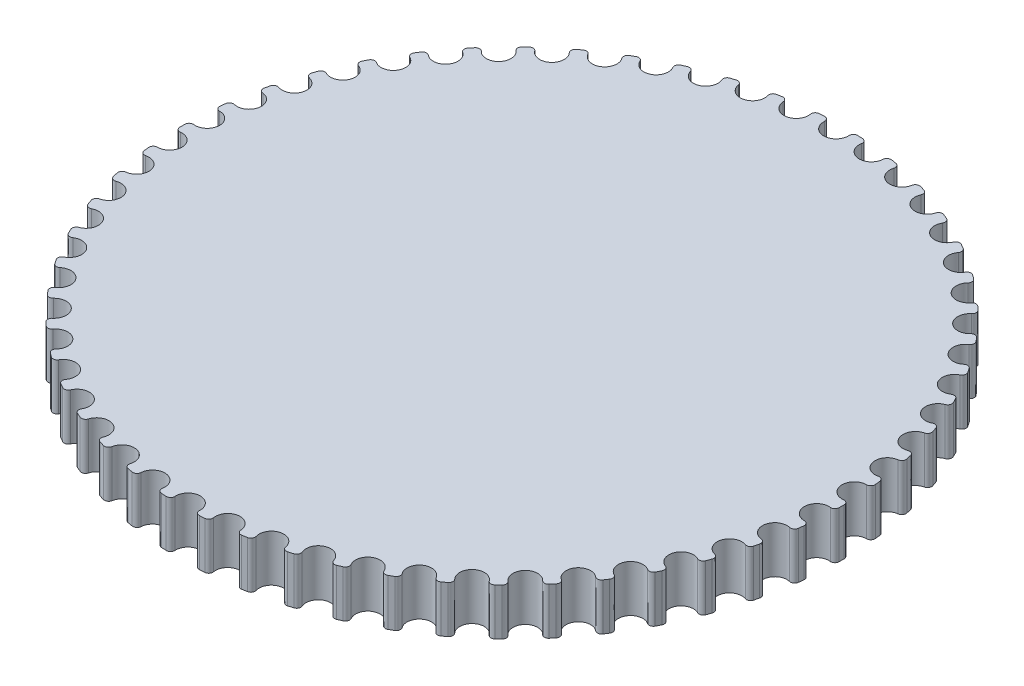
from build123d import *

# Parameters (mm, degrees)
BOSS_EXTRUDE1_DEPTH = 5.999999938


with BuildPart() as part:
    # Sketch1 → Boss-Extrude1 (new body)
    with BuildSketch(Plane(origin=(0, 0, 0), x_dir=(1, 0, 0), z_dir=(0, 1, 0))):
        with BuildLine():
            ThreePointArc((41.613520685, 0.849001706), (39.857037717, 2.321408094), (41.430708027, 3.987773823))
            ThreePointArc((41.430708027, 3.987773823), (41.828156273, 4.164854384), (41.961479983, 4.57903722))
            ThreePointArc((41.961479983, 4.57903722), (41.943633136, 4.739728218), (41.925170927, 4.90034968))
            ThreePointArc((41.925170927, 4.90034968), (41.906093626, 5.060899247), (41.886401515, 5.221374565))
            ThreePointArc((41.886401515, 5.221374565), (41.661154427, 5.593646485), (41.233581862, 5.674295944))
            ThreePointArc((41.233581862, 5.674295944), (39.318039656, 6.93283122), (40.687616117, 8.770621552))
            ThreePointArc((40.687616117, 8.770621552), (41.061819161, 8.992645683), (41.146157692, 9.4195059))
            ThreePointArc((41.146157692, 9.4195059), (41.109776432, 9.577038471), (41.072792045, 9.734430536))
            ThreePointArc((41.072792045, 9.734430536), (41.035205071, 9.891679785), (40.997016063, 10.048783912))
            ThreePointArc((40.997016063, 10.048783912), (40.730073884, 10.392389072), (40.296029581, 10.422855063))
            ThreePointArc((40.296029581, 10.422855063), (38.247332558, 11.450499697), (39.394293997, 13.43486167))
            ThreePointArc((39.394293997, 13.43486167), (39.740191387, 13.698826875), (39.774404204, 14.132591923))
            ThreePointArc((39.774404204, 14.132591923), (39.719980526, 14.284835708), (39.66497411, 14.436869919))
            ThreePointArc((39.66497411, 14.436869919), (39.609385763, 14.588692324), (39.553216299, 14.740300695))
            ThreePointArc((39.553216299, 14.740300695), (39.248188963, 15.050592425), (38.813542627, 15.030462947))
            ThreePointArc((38.813542627, 15.030462947), (36.6593959, 15.813319808), (37.568231632, 17.917418332))
            ThreePointArc((37.568231632, 17.917418332), (37.881145697, 18.219754935), (37.864770131, 18.654558884))
            ThreePointArc((37.864770131, 18.654558884), (37.793040022, 18.799455048), (37.720755445, 18.944075402))
            ThreePointArc((37.720755445, 18.944075402), (37.647917461, 19.088417825), (37.574527138, 19.232480199))
            ThreePointArc((37.574527138, 19.232480199), (37.235539616, 19.505262334), (36.806169093, 19.434809605))
            ThreePointArc((36.806169093, 19.434809605), (34.575703801, 19.962291897), (35.234123382, 22.157672648))
            ThreePointArc((35.234123382, 22.157672648), (35.509822497, 22.494292064), (35.443079999, 22.924254937))
            ThreePointArc((35.443079999, 22.924254937), (35.355013485, 23.059844008), (35.266428272, 23.195094764))
            ThreePointArc((35.266428272, 23.195094764), (35.17732566, 23.330005221), (35.087706955, 23.4645734))
            ThreePointArc((35.087706955, 23.4645734), (34.719343473, 23.696157031), (34.301055262, 23.576333803))
            ThreePointArc((34.301055262, 23.576333803), (32.024434622, 23.841308233), (32.423534056, 26.098282452))
            ThreePointArc((32.423534056, 26.098282452), (32.658289863, 26.464632482), (32.542083011, 26.883939769))
            ThreePointArc((32.542083011, 26.883939769), (32.438871042, 27.008388137), (32.335183156, 27.13244026))
            ThreePointArc((32.335183156, 27.13244026), (32.231020875, 27.256094319), (32.126385728, 27.379348499))
            ThreePointArc((32.126385728, 27.379348499), (31.733627769, 27.566601854), (31.332078502, 27.399028531))
            ThreePointArc((31.332078502, 27.399028531), (29.040089902, 27.397911774), (29.174472055, 29.685957758))
            ThreePointArc((29.174472055, 29.685957758), (29.365109884, 30.077084145), (29.201010177, 30.480065434))
            ThreePointArc((29.201010177, 30.480065434), (29.084048516, 30.591690148), (28.966660158, 30.702866047))
            ThreePointArc((28.966660158, 30.702866047), (28.848846825, 30.813591499), (28.730610247, 30.923864879))
            ThreePointArc((28.730610247, 30.923864879), (28.318769189, 31.064255678), (27.939389129, 30.8511984))
            ThreePointArc((27.939389129, 30.8511984), (25.663027784, 30.584005559), (25.530875367, 32.87218141))
            ThreePointArc((25.530875367, 32.87218141), (25.67481717, 33.282794842), (25.465043773, 33.664000502))
            ThreePointArc((25.465043773, 33.664000502), (25.335914127, 33.76129203), (25.206412773, 33.858088241))
            ThreePointArc((25.206412773, 33.858088241), (25.076541612, 33.954387713), (24.946302549, 34.050189036))
            ThreePointArc((24.946302549, 34.050189036), (24.520947836, 34.141818734), (24.168867449, 33.886158737))
            ThreePointArc((24.168867449, 33.886158737), (21.93891724, 33.356503135), (21.542017388, 35.613865201))
            ThreePointArc((21.542017388, 35.613865201), (21.637316598, 36.038412835), (21.384706338, 36.392687714))
            ThreePointArc((21.384706338, 36.392687714), (21.245154963, 36.474330354), (21.105291897, 36.555437874))
            ThreePointArc((21.105291897, 36.555437874), (20.965119191, 36.636009082), (20.824638903, 36.716042798))
            ThreePointArc((20.824638903, 36.716042798), (20.391522728, 36.757672261), (20.071503297, 36.462866907))
            ThreePointArc((20.071503297, 36.462866907), (17.918120476, 35.677911229), (17.261840578, 37.873932559))
            ThreePointArc((17.261840578, 37.873932559), (17.307208437, 38.306673117), (17.015177434, 38.629226255))
            ThreePointArc((17.015177434, 38.629226255), (16.867091524, 38.694115932), (16.718758153, 38.75843792))
            ThreePointArc((16.718758153, 38.75843792), (16.570179499, 38.822191277), (16.421357741, 38.885375067))
            ThreePointArc((16.421357741, 38.885375067), (15.986337257, 38.876441328), (15.702706495, 38.546477354))
            ThreePointArc((15.702706495, 38.546477354), (13.655011871, 37.516836779), (12.748226987, 39.621819952))
            ThreePointArc((12.748226987, 39.621819952), (12.743049972, 40.056901361), (12.415547445, 40.343370779))
            ThreePointArc((12.415547445, 40.343370779), (12.260929607, 40.39062997), (12.106131887, 40.437296583))
            ThreePointArc((12.106131887, 40.437296583), (11.951156555, 40.483369934), (11.796005887, 40.528849346))
            ThreePointArc((11.796005887, 40.528849346), (11.364963999, 40.469473217), (11.121557526, 40.10881282))
            ThreePointArc((11.121557526, 40.10881282), (9.207242656, 38.84841147), (8.062215496, 40.833890201))
            ThreePointArc((8.062215496, 40.833890201), (8.006563617, 41.26542873), (7.648018475, 41.511940422))
            ThreePointArc((7.648018475, 41.511940422), (7.488959651, 41.540930028), (7.329790954, 41.569310179))
            ThreePointArc((7.329790954, 41.569310179), (7.170514721, 41.597080461), (7.011133288, 41.624240464))
            ThreePointArc((7.011133288, 41.624240464), (6.5898991, 41.515224907), (6.390008571, 41.128745399))
            ThreePointArc((6.390008571, 41.128745399), (4.634961278, 39.654628041), (3.26717637, 41.493752135))
            ThreePointArc((3.26717637, 41.493752135), (3.161802225, 41.915911965), (2.777063176, 42.119132284))
            ThreePointArc((2.777063176, 42.119132284), (2.615714362, 42.129460269), (2.454327173, 42.139170167))
            ThreePointArc((2.454327173, 42.139170167), (2.292903976, 42.148261833), (2.131447139, 42.156735136))
            ThreePointArc((2.131447139, 42.156735136), (1.725717119, 41.999554398), (1.572045711, 41.592482253))
            ThreePointArc((1.572045711, 41.592482253), (0, 39.924583794), (-1.572045711, 41.592482253))
            ThreePointArc((-1.572045711, 41.592482253), (-1.725717119, 41.999554398), (-2.131447139, 42.156735136))
            ThreePointArc((-2.131447139, 42.156735136), (-2.292903976, 42.148261833), (-2.454327173, 42.139170167))
            ThreePointArc((-2.454327173, 42.139170167), (-2.615714362, 42.129460269), (-2.777063176, 42.119132284))
            ThreePointArc((-2.777063176, 42.119132284), (-3.161802225, 41.915911965), (-3.26717637, 41.493752135))
            ThreePointArc((-3.26717637, 41.493752135), (-4.634961278, 39.654628041), (-6.390008571, 41.128745399))
            ThreePointArc((-6.390008571, 41.128745399), (-6.5898991, 41.515224907), (-7.011133288, 41.624240464))
            ThreePointArc((-7.011133288, 41.624240464), (-7.170514721, 41.597080461), (-7.329790954, 41.569310179))
            ThreePointArc((-7.329790954, 41.569310179), (-7.488959651, 41.540930028), (-7.648018475, 41.511940422))
            ThreePointArc((-7.648018475, 41.511940422), (-8.006563617, 41.26542873), (-8.062215496, 40.833890201))
            ThreePointArc((-8.062215496, 40.833890201), (-9.207242656, 38.84841147), (-11.121557526, 40.10881282))
            ThreePointArc((-11.121557526, 40.10881282), (-11.364963999, 40.469473217), (-11.796005887, 40.528849346))
            ThreePointArc((-11.796005887, 40.528849346), (-11.951156555, 40.483369934), (-12.106131887, 40.437296583))
            ThreePointArc((-12.106131887, 40.437296583), (-12.260929607, 40.39062997), (-12.415547445, 40.343370779))
            ThreePointArc((-12.415547445, 40.343370779), (-12.743049972, 40.056901361), (-12.748226987, 39.621819952))
            ThreePointArc((-12.748226987, 39.621819952), (-13.655011871, 37.516836779), (-15.702706495, 38.546477354))
            ThreePointArc((-15.702706495, 38.546477354), (-15.986337257, 38.876441328), (-16.421357741, 38.885375067))
            ThreePointArc((-16.421357741, 38.885375067), (-16.570179499, 38.822191277), (-16.718758153, 38.75843792))
            ThreePointArc((-16.718758153, 38.75843792), (-16.867091524, 38.694115932), (-17.015177434, 38.629226255))
            ThreePointArc((-17.015177434, 38.629226255), (-17.307208437, 38.306673117), (-17.261840578, 37.873932559))
            ThreePointArc((-17.261840578, 37.873932559), (-17.918120476, 35.677911229), (-20.071503297, 36.462866907))
            ThreePointArc((-20.071503297, 36.462866907), (-20.391522728, 36.757672261), (-20.824638903, 36.716042798))
            ThreePointArc((-20.824638903, 36.716042798), (-20.965119191, 36.636009082), (-21.105291897, 36.555437874))
            ThreePointArc((-21.105291897, 36.555437874), (-21.245154963, 36.474330354), (-21.384706338, 36.392687714))
            ThreePointArc((-21.384706338, 36.392687714), (-21.637316598, 36.038412835), (-21.542017388, 35.613865201))
            ThreePointArc((-21.542017388, 35.613865201), (-21.93891724, 33.356503135), (-24.168867449, 33.886158737))
            ThreePointArc((-24.168867449, 33.886158737), (-24.520947836, 34.141818734), (-24.946302549, 34.050189036))
            ThreePointArc((-24.946302549, 34.050189036), (-25.076541612, 33.954387713), (-25.206412773, 33.858088241))
            ThreePointArc((-25.206412773, 33.858088241), (-25.335914127, 33.76129203), (-25.465043773, 33.664000502))
            ThreePointArc((-25.465043773, 33.664000502), (-25.67481717, 33.282794842), (-25.530875367, 32.87218141))
            ThreePointArc((-25.530875367, 32.87218141), (-25.663027784, 30.584005559), (-27.939389129, 30.8511984))
            ThreePointArc((-27.939389129, 30.8511984), (-28.318769189, 31.064255678), (-28.730610247, 30.923864879))
            ThreePointArc((-28.730610247, 30.923864879), (-28.848846825, 30.813591499), (-28.966660158, 30.702866047))
            ThreePointArc((-28.966660158, 30.702866047), (-29.084048516, 30.591690148), (-29.201010177, 30.480065434))
            ThreePointArc((-29.201010177, 30.480065434), (-29.365109884, 30.077084145), (-29.174472055, 29.685957758))
            ThreePointArc((-29.174472055, 29.685957758), (-29.040089902, 27.397911774), (-31.332078502, 27.399028531))
            ThreePointArc((-31.332078502, 27.399028531), (-31.733627769, 27.566601854), (-32.126385728, 27.379348499))
            ThreePointArc((-32.126385728, 27.379348499), (-32.231020875, 27.256094319), (-32.335183156, 27.13244026))
            ThreePointArc((-32.335183156, 27.13244026), (-32.438871042, 27.008388137), (-32.542083011, 26.883939769))
            ThreePointArc((-32.542083011, 26.883939769), (-32.658289863, 26.464632482), (-32.423534056, 26.098282452))
            ThreePointArc((-32.423534056, 26.098282452), (-32.024434622, 23.841308233), (-34.301055262, 23.576333803))
            ThreePointArc((-34.301055262, 23.576333803), (-34.719343473, 23.696157031), (-35.087706955, 23.4645734))
            ThreePointArc((-35.087706955, 23.4645734), (-35.17732566, 23.330005221), (-35.266428272, 23.195094764))
            ThreePointArc((-35.266428272, 23.195094764), (-35.355013485, 23.059844008), (-35.443079999, 22.924254937))
            ThreePointArc((-35.443079999, 22.924254937), (-35.509822497, 22.494292064), (-35.234123382, 22.157672648))
            ThreePointArc((-35.234123382, 22.157672648), (-34.575703801, 19.962291897), (-36.806169093, 19.434809605))
            ThreePointArc((-36.806169093, 19.434809605), (-37.235539616, 19.505262334), (-37.574527138, 19.232480199))
            ThreePointArc((-37.574527138, 19.232480199), (-37.647917461, 19.088417825), (-37.720755445, 18.944075402))
            ThreePointArc((-37.720755445, 18.944075402), (-37.793040022, 18.799455048), (-37.864770131, 18.654558884))
            ThreePointArc((-37.864770131, 18.654558884), (-37.881145697, 18.219754935), (-37.568231632, 17.917418332))
            ThreePointArc((-37.568231632, 17.917418332), (-36.6593959, 15.813319808), (-38.813542627, 15.030462947))
            ThreePointArc((-38.813542627, 15.030462947), (-39.248188963, 15.050592425), (-39.553216299, 14.740300695))
            ThreePointArc((-39.553216299, 14.740300695), (-39.609385763, 14.588692324), (-39.66497411, 14.436869919))
            ThreePointArc((-39.66497411, 14.436869919), (-39.719980526, 14.284835708), (-39.774404204, 14.132591923))
            ThreePointArc((-39.774404204, 14.132591923), (-39.740191387, 13.698826875), (-39.394293997, 13.43486167))
            ThreePointArc((-39.394293997, 13.43486167), (-38.247332558, 11.450499697), (-40.296029581, 10.422855063))
            ThreePointArc((-40.296029581, 10.422855063), (-40.730073884, 10.392389072), (-40.997016063, 10.048783912))
            ThreePointArc((-40.997016063, 10.048783912), (-41.035205071, 9.891679785), (-41.072792045, 9.734430536))
            ThreePointArc((-41.072792045, 9.734430536), (-41.109776432, 9.577038471), (-41.146157692, 9.4195059))
            ThreePointArc((-41.146157692, 9.4195059), (-41.061819161, 8.992645683), (-40.687616117, 8.770621552))
            ThreePointArc((-40.687616117, 8.770621552), (-39.318039656, 6.93283122), (-41.233581862, 5.674295944))
            ThreePointArc((-41.233581862, 5.674295944), (-41.661154427, 5.593646485), (-41.886401515, 5.221374565))
            ThreePointArc((-41.886401515, 5.221374565), (-41.906093626, 5.060899247), (-41.925170927, 4.90034968))
            ThreePointArc((-41.925170927, 4.90034968), (-41.943633136, 4.739728218), (-41.961479983, 4.57903722))
            ThreePointArc((-41.961479983, 4.57903722), (-41.828156273, 4.164854384), (-41.430708027, 3.987773823))
            ThreePointArc((-41.430708027, 3.987773823), (-39.857037717, 2.321408094), (-41.613520685, 0.849001706))
            ThreePointArc((-41.613520685, 0.849001706), (-42.028839326, 0.719259426), (-42.209345241, 0.323355084))
            ThreePointArc((-42.209345241, 0.323355084), (-42.210274154, 0.161678728), (-42.210583794, 0))
            ThreePointArc((-42.210583794, 0), (-42.210274154, -0.161678728), (-42.209345241, -0.323355084))
            ThreePointArc((-42.209345241, -0.323355084), (-42.028839326, -0.719259426), (-41.613520685, -0.849001706))
            ThreePointArc((-41.613520685, -0.849001706), (-39.857037717, -2.321408094), (-41.430708027, -3.987773823))
            ThreePointArc((-41.430708027, -3.987773823), (-41.828156273, -4.164854384), (-41.961479983, -4.57903722))
            ThreePointArc((-41.961479983, -4.57903722), (-41.943633136, -4.739728218), (-41.925170927, -4.90034968))
            ThreePointArc((-41.925170927, -4.90034968), (-41.906093626, -5.060899247), (-41.886401515, -5.221374565))
            ThreePointArc((-41.886401515, -5.221374565), (-41.661154427, -5.593646485), (-41.233581862, -5.674295944))
            ThreePointArc((-41.233581862, -5.674295944), (-39.318039656, -6.93283122), (-40.687616117, -8.770621552))
            ThreePointArc((-40.687616117, -8.770621552), (-41.061819161, -8.992645683), (-41.146157692, -9.4195059))
            ThreePointArc((-41.146157692, -9.4195059), (-41.109776432, -9.577038471), (-41.072792045, -9.734430536))
            ThreePointArc((-41.072792045, -9.734430536), (-41.035205071, -9.891679785), (-40.997016063, -10.048783912))
            ThreePointArc((-40.997016063, -10.048783912), (-40.730073884, -10.392389072), (-40.296029581, -10.422855063))
            ThreePointArc((-40.296029581, -10.422855063), (-38.247332558, -11.450499697), (-39.394293997, -13.43486167))
            ThreePointArc((-39.394293997, -13.43486167), (-39.740191387, -13.698826875), (-39.774404204, -14.132591923))
            ThreePointArc((-39.774404204, -14.132591923), (-39.719980526, -14.284835708), (-39.66497411, -14.436869919))
            ThreePointArc((-39.66497411, -14.436869919), (-39.609385763, -14.588692324), (-39.553216299, -14.740300695))
            ThreePointArc((-39.553216299, -14.740300695), (-39.248188963, -15.050592425), (-38.813542627, -15.030462947))
            ThreePointArc((-38.813542627, -15.030462947), (-36.6593959, -15.813319808), (-37.568231632, -17.917418332))
            ThreePointArc((-37.568231632, -17.917418332), (-37.881145697, -18.219754935), (-37.864770131, -18.654558884))
            ThreePointArc((-37.864770131, -18.654558884), (-37.793040022, -18.799455048), (-37.720755445, -18.944075402))
            ThreePointArc((-37.720755445, -18.944075402), (-37.647917461, -19.088417825), (-37.574527138, -19.232480199))
            ThreePointArc((-37.574527138, -19.232480199), (-37.235539616, -19.505262334), (-36.806169093, -19.434809605))
            ThreePointArc((-36.806169093, -19.434809605), (-34.575703801, -19.962291897), (-35.234123382, -22.157672648))
            ThreePointArc((-35.234123382, -22.157672648), (-35.509822497, -22.494292064), (-35.443079999, -22.924254937))
            ThreePointArc((-35.443079999, -22.924254937), (-35.355013485, -23.059844008), (-35.266428272, -23.195094764))
            ThreePointArc((-35.266428272, -23.195094764), (-35.17732566, -23.330005221), (-35.087706955, -23.4645734))
            ThreePointArc((-35.087706955, -23.4645734), (-34.719343473, -23.696157031), (-34.301055262, -23.576333803))
            ThreePointArc((-34.301055262, -23.576333803), (-32.024434622, -23.841308233), (-32.423534056, -26.098282452))
            ThreePointArc((-32.423534056, -26.098282452), (-32.658289863, -26.464632482), (-32.542083011, -26.883939769))
            ThreePointArc((-32.542083011, -26.883939769), (-32.438871042, -27.008388137), (-32.335183156, -27.13244026))
            ThreePointArc((-32.335183156, -27.13244026), (-32.231020875, -27.256094319), (-32.126385728, -27.379348499))
            ThreePointArc((-32.126385728, -27.379348499), (-31.733627769, -27.566601854), (-31.332078502, -27.399028531))
            ThreePointArc((-31.332078502, -27.399028531), (-29.040089902, -27.397911774), (-29.174472055, -29.685957758))
            ThreePointArc((-29.174472055, -29.685957758), (-29.365109884, -30.077084145), (-29.201010177, -30.480065434))
            ThreePointArc((-29.201010177, -30.480065434), (-29.084048516, -30.591690148), (-28.966660158, -30.702866047))
            ThreePointArc((-28.966660158, -30.702866047), (-28.848846825, -30.813591499), (-28.730610247, -30.923864879))
            ThreePointArc((-28.730610247, -30.923864879), (-28.318769189, -31.064255678), (-27.939389129, -30.8511984))
            ThreePointArc((-27.939389129, -30.8511984), (-25.663027784, -30.584005559), (-25.530875367, -32.87218141))
            ThreePointArc((-25.530875367, -32.87218141), (-25.67481717, -33.282794842), (-25.465043773, -33.664000502))
            ThreePointArc((-25.465043773, -33.664000502), (-25.335914127, -33.76129203), (-25.206412773, -33.858088241))
            ThreePointArc((-25.206412773, -33.858088241), (-25.076541612, -33.954387713), (-24.946302549, -34.050189036))
            ThreePointArc((-24.946302549, -34.050189036), (-24.520947836, -34.141818734), (-24.168867449, -33.886158737))
            ThreePointArc((-24.168867449, -33.886158737), (-21.93891724, -33.356503135), (-21.542017388, -35.613865201))
            ThreePointArc((-21.542017388, -35.613865201), (-21.637316598, -36.038412835), (-21.384706338, -36.392687714))
            ThreePointArc((-21.384706338, -36.392687714), (-21.245154963, -36.474330354), (-21.105291897, -36.555437874))
            ThreePointArc((-21.105291897, -36.555437874), (-20.965119191, -36.636009082), (-20.824638903, -36.716042798))
            ThreePointArc((-20.824638903, -36.716042798), (-20.391522728, -36.757672261), (-20.071503297, -36.462866907))
            ThreePointArc((-20.071503297, -36.462866907), (-17.918120476, -35.677911229), (-17.261840578, -37.873932559))
            ThreePointArc((-17.261840578, -37.873932559), (-17.307208437, -38.306673117), (-17.015177434, -38.629226255))
            ThreePointArc((-17.015177434, -38.629226255), (-16.867091524, -38.694115932), (-16.718758153, -38.75843792))
            ThreePointArc((-16.718758153, -38.75843792), (-16.570179499, -38.822191277), (-16.421357741, -38.885375067))
            ThreePointArc((-16.421357741, -38.885375067), (-15.986337257, -38.876441328), (-15.702706495, -38.546477354))
            ThreePointArc((-15.702706495, -38.546477354), (-13.655011871, -37.516836779), (-12.748226987, -39.621819952))
            ThreePointArc((-12.748226987, -39.621819952), (-12.743049972, -40.056901361), (-12.415547445, -40.343370779))
            ThreePointArc((-12.415547445, -40.343370779), (-12.260929607, -40.39062997), (-12.106131887, -40.437296583))
            ThreePointArc((-12.106131887, -40.437296583), (-11.951156555, -40.483369934), (-11.796005887, -40.528849346))
            ThreePointArc((-11.796005887, -40.528849346), (-11.364963999, -40.469473217), (-11.121557526, -40.10881282))
            ThreePointArc((-11.121557526, -40.10881282), (-9.207242656, -38.84841147), (-8.062215496, -40.833890201))
            ThreePointArc((-8.062215496, -40.833890201), (-8.006563617, -41.26542873), (-7.648018475, -41.511940422))
            ThreePointArc((-7.648018475, -41.511940422), (-7.488959651, -41.540930028), (-7.329790954, -41.569310179))
            ThreePointArc((-7.329790954, -41.569310179), (-7.170514721, -41.597080461), (-7.011133288, -41.624240464))
            ThreePointArc((-7.011133288, -41.624240464), (-6.5898991, -41.515224907), (-6.390008571, -41.128745399))
            ThreePointArc((-6.390008571, -41.128745399), (-4.634961278, -39.654628041), (-3.26717637, -41.493752135))
            ThreePointArc((-3.26717637, -41.493752135), (-3.161802225, -41.915911965), (-2.777063176, -42.119132284))
            ThreePointArc((-2.777063176, -42.119132284), (-2.615714362, -42.129460269), (-2.454327173, -42.139170167))
            ThreePointArc((-2.454327173, -42.139170167), (-2.292903976, -42.148261833), (-2.131447139, -42.156735136))
            ThreePointArc((-2.131447139, -42.156735136), (-1.725717119, -41.999554398), (-1.572045711, -41.592482253))
            ThreePointArc((-1.572045711, -41.592482253), (0, -39.924583794), (1.572045711, -41.592482253))
            ThreePointArc((1.572045711, -41.592482253), (1.725717119, -41.999554398), (2.131447139, -42.156735136))
            ThreePointArc((2.131447139, -42.156735136), (2.292903976, -42.148261833), (2.454327173, -42.139170167))
            ThreePointArc((2.454327173, -42.139170167), (2.615714362, -42.129460269), (2.777063176, -42.119132284))
            ThreePointArc((2.777063176, -42.119132284), (3.161802225, -41.915911965), (3.26717637, -41.493752135))
            ThreePointArc((3.26717637, -41.493752135), (4.634961278, -39.654628041), (6.390008571, -41.128745399))
            ThreePointArc((6.390008571, -41.128745399), (6.5898991, -41.515224907), (7.011133288, -41.624240464))
            ThreePointArc((7.011133288, -41.624240464), (7.170514721, -41.597080461), (7.329790954, -41.569310179))
            ThreePointArc((7.329790954, -41.569310179), (7.488959651, -41.540930028), (7.648018475, -41.511940422))
            ThreePointArc((7.648018475, -41.511940422), (8.006563617, -41.26542873), (8.062215496, -40.833890201))
            ThreePointArc((8.062215496, -40.833890201), (9.207242656, -38.84841147), (11.121557526, -40.10881282))
            ThreePointArc((11.121557526, -40.10881282), (11.364963999, -40.469473217), (11.796005887, -40.528849346))
            ThreePointArc((11.796005887, -40.528849346), (11.951156555, -40.483369934), (12.106131887, -40.437296583))
            ThreePointArc((12.106131887, -40.437296583), (12.260929607, -40.39062997), (12.415547445, -40.343370779))
            ThreePointArc((12.415547445, -40.343370779), (12.743049972, -40.056901361), (12.748226987, -39.621819952))
            ThreePointArc((12.748226987, -39.621819952), (13.655011871, -37.516836779), (15.702706495, -38.546477354))
            ThreePointArc((15.702706495, -38.546477354), (15.986337257, -38.876441328), (16.421357741, -38.885375067))
            ThreePointArc((16.421357741, -38.885375067), (16.570179499, -38.822191277), (16.718758153, -38.75843792))
            ThreePointArc((16.718758153, -38.75843792), (16.867091524, -38.694115932), (17.015177434, -38.629226255))
            ThreePointArc((17.015177434, -38.629226255), (17.307208437, -38.306673117), (17.261840578, -37.873932559))
            ThreePointArc((17.261840578, -37.873932559), (17.918120476, -35.677911229), (20.071503297, -36.462866907))
            ThreePointArc((20.071503297, -36.462866907), (20.391522728, -36.757672261), (20.824638903, -36.716042798))
            ThreePointArc((20.824638903, -36.716042798), (20.965119191, -36.636009082), (21.105291897, -36.555437874))
            ThreePointArc((21.105291897, -36.555437874), (21.245154963, -36.474330354), (21.384706338, -36.392687714))
            ThreePointArc((21.384706338, -36.392687714), (21.637316598, -36.038412835), (21.542017388, -35.613865201))
            ThreePointArc((21.542017388, -35.613865201), (21.93891724, -33.356503135), (24.168867449, -33.886158737))
            ThreePointArc((24.168867449, -33.886158737), (24.520947836, -34.141818734), (24.946302549, -34.050189036))
            ThreePointArc((24.946302549, -34.050189036), (25.076541612, -33.954387713), (25.206412773, -33.858088241))
            ThreePointArc((25.206412773, -33.858088241), (25.335914127, -33.76129203), (25.465043773, -33.664000502))
            ThreePointArc((25.465043773, -33.664000502), (25.67481717, -33.282794842), (25.530875367, -32.87218141))
            ThreePointArc((25.530875367, -32.87218141), (25.663027784, -30.584005559), (27.939389129, -30.8511984))
            ThreePointArc((27.939389129, -30.8511984), (28.318769189, -31.064255678), (28.730610247, -30.923864879))
            ThreePointArc((28.730610247, -30.923864879), (28.848846825, -30.813591499), (28.966660158, -30.702866047))
            ThreePointArc((28.966660158, -30.702866047), (29.084048516, -30.591690148), (29.201010177, -30.480065434))
            ThreePointArc((29.201010177, -30.480065434), (29.365109884, -30.077084145), (29.174472055, -29.685957758))
            ThreePointArc((29.174472055, -29.685957758), (29.040089902, -27.397911774), (31.332078502, -27.399028531))
            ThreePointArc((31.332078502, -27.399028531), (31.733627769, -27.566601854), (32.126385728, -27.379348499))
            ThreePointArc((32.126385728, -27.379348499), (32.231020875, -27.256094319), (32.335183156, -27.13244026))
            ThreePointArc((32.335183156, -27.13244026), (32.438871042, -27.008388137), (32.542083011, -26.883939769))
            ThreePointArc((32.542083011, -26.883939769), (32.658289863, -26.464632482), (32.423534056, -26.098282452))
            ThreePointArc((32.423534056, -26.098282452), (32.024434622, -23.841308233), (34.301055262, -23.576333803))
            ThreePointArc((34.301055262, -23.576333803), (34.719343473, -23.696157031), (35.087706955, -23.4645734))
            ThreePointArc((35.087706955, -23.4645734), (35.17732566, -23.330005221), (35.266428272, -23.195094764))
            ThreePointArc((35.266428272, -23.195094764), (35.355013485, -23.059844008), (35.443079999, -22.924254937))
            ThreePointArc((35.443079999, -22.924254937), (35.509822497, -22.494292064), (35.234123382, -22.157672648))
            ThreePointArc((35.234123382, -22.157672648), (34.575703801, -19.962291897), (36.806169093, -19.434809605))
            ThreePointArc((36.806169093, -19.434809605), (37.235539616, -19.505262334), (37.574527138, -19.232480199))
            ThreePointArc((37.574527138, -19.232480199), (37.647917461, -19.088417825), (37.720755445, -18.944075402))
            ThreePointArc((37.720755445, -18.944075402), (37.793040022, -18.799455048), (37.864770131, -18.654558884))
            ThreePointArc((37.864770131, -18.654558884), (37.881145697, -18.219754935), (37.568231632, -17.917418332))
            ThreePointArc((37.568231632, -17.917418332), (36.6593959, -15.813319808), (38.813542627, -15.030462947))
            ThreePointArc((38.813542627, -15.030462947), (39.248188963, -15.050592425), (39.553216299, -14.740300695))
            ThreePointArc((39.553216299, -14.740300695), (39.609385763, -14.588692324), (39.66497411, -14.436869919))
            ThreePointArc((39.66497411, -14.436869919), (39.719980526, -14.284835708), (39.774404204, -14.132591923))
            ThreePointArc((39.774404204, -14.132591923), (39.740191387, -13.698826875), (39.394293997, -13.43486167))
            ThreePointArc((39.394293997, -13.43486167), (38.247332558, -11.450499697), (40.296029581, -10.422855063))
            ThreePointArc((40.296029581, -10.422855063), (40.730073884, -10.392389072), (40.997016063, -10.048783912))
            ThreePointArc((40.997016063, -10.048783912), (41.035205071, -9.891679785), (41.072792045, -9.734430536))
            ThreePointArc((41.072792045, -9.734430536), (41.109776432, -9.577038471), (41.146157692, -9.4195059))
            ThreePointArc((41.146157692, -9.4195059), (41.061819161, -8.992645683), (40.687616117, -8.770621552))
            ThreePointArc((40.687616117, -8.770621552), (39.318039656, -6.93283122), (41.233581862, -5.674295944))
            ThreePointArc((41.233581862, -5.674295944), (41.661154427, -5.593646485), (41.886401515, -5.221374565))
            ThreePointArc((41.886401515, -5.221374565), (41.906093626, -5.060899247), (41.925170927, -4.90034968))
            ThreePointArc((41.925170927, -4.90034968), (41.943633136, -4.739728218), (41.961479983, -4.57903722))
            ThreePointArc((41.961479983, -4.57903722), (41.828156273, -4.164854384), (41.430708027, -3.987773823))
            ThreePointArc((41.430708027, -3.987773823), (39.857037717, -2.321408094), (41.613520685, -0.849001706))
            ThreePointArc((41.613520685, -0.849001706), (42.028839326, -0.719259426), (42.209345241, -0.323355084))
            ThreePointArc((42.209345241, -0.323355084), (42.210274154, -0.161678728), (42.210583794, 0))
            ThreePointArc((42.210583794, 0), (42.210274154, 0.161678728), (42.209345241, 0.323355084))
            ThreePointArc((42.209345241, 0.323355084), (42.028839326, 0.719259426), (41.613520685, 0.849001706))
        make_face()
    extrude(amount=BOSS_EXTRUDE1_DEPTH)


solid = part.part
